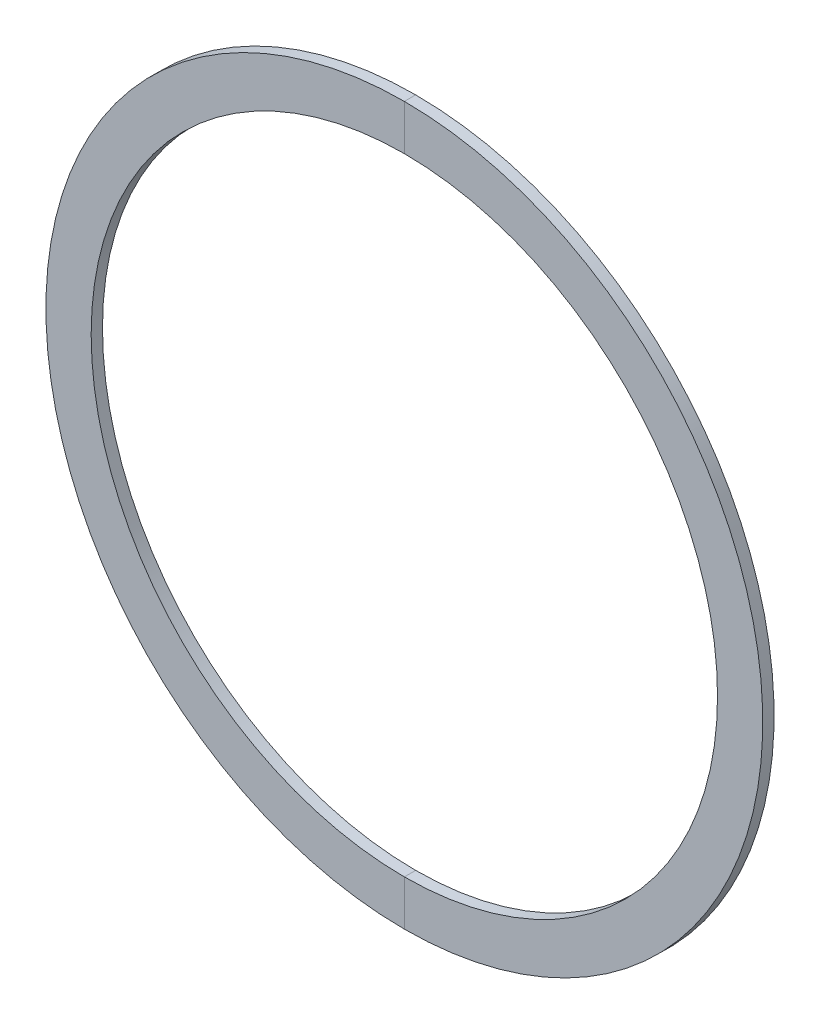
from build123d import *

# Parameters (mm, degrees)
BOSS_EXTRUDE1_DEPTH = 3.175


with BuildPart() as part:
    # Sketch2 → Boss-Extrude1 (new body)
    with BuildSketch(Plane.XY):
        with BuildLine():
            ThreePointArc((-1.783927604, 106.664181958), (-86.289926541, 57.796410124), (-89.548347912, -39.767444199))
            ThreePointArc((-89.548347912, -39.767444199), (-89.139366423, -40.557656379), (-88.723411943, -41.344220438))
            ThreePointArc((-88.723411943, -41.344220438), (-88.300763494, -42.126623343), (-87.87121564, -42.905259753))
            ThreePointArc((-87.87121564, -42.905259753), (0, -94.523651503), (87.87121564, -42.905259753))
            ThreePointArc((87.87121564, -42.905259753), (88.300763494, -42.126623343), (88.723411943, -41.344220438))
            ThreePointArc((88.723411943, -41.344220438), (89.139366423, -40.557656379), (89.548347912, -39.767444199))
            ThreePointArc((89.548347912, -39.767444199), (86.289926541, 57.796410124), (1.783927604, 106.664181958))
            ThreePointArc((1.783927604, 106.664181958), (0.891998866, 106.676045412), (0, 106.68))
            ThreePointArc((0, 106.68), (-0.891998866, 106.676045412), (-1.783927604, 106.664181958))
        make_face()
        with BuildLine():
            ThreePointArc((-7.652045127, 93.646303016), (0, -81.823651503), (7.652045127, 93.646303016))
            ThreePointArc((7.652045127, 93.646303016), (4.717664566, 93.853310885), (1.778000524, 93.962016248))
            ThreePointArc((1.778000524, 93.962016248), (0.889045735, 93.975503947), (0, 93.98))
            ThreePointArc((0, 93.98), (-0.889045735, 93.975503947), (-1.778000524, 93.962016248))
            ThreePointArc((-1.778000524, 93.962016248), (-4.717664566, 93.853310885), (-7.652045127, 93.646303016))
        make_face(mode=Mode.SUBTRACT)
    extrude(amount=-BOSS_EXTRUDE1_DEPTH)


with BuildPart() as body_2:
    # Split1: the piece on the far side of the plane
    add(part.part)
    split(bisect_by=Plane(origin=(0, 0, 0), x_dir=(0, 0, 1), z_dir=(1, 0, 0)), keep=Keep.BOTTOM)


with BuildPart() as part_1:
    add(part.part)

    # Split1
    split(bisect_by=Plane(origin=(0, 0, 0), x_dir=(0, 0, 1), z_dir=(1, 0, 0)), keep=Keep.TOP)


solid = Compound([body_2.part, part_1.part])
